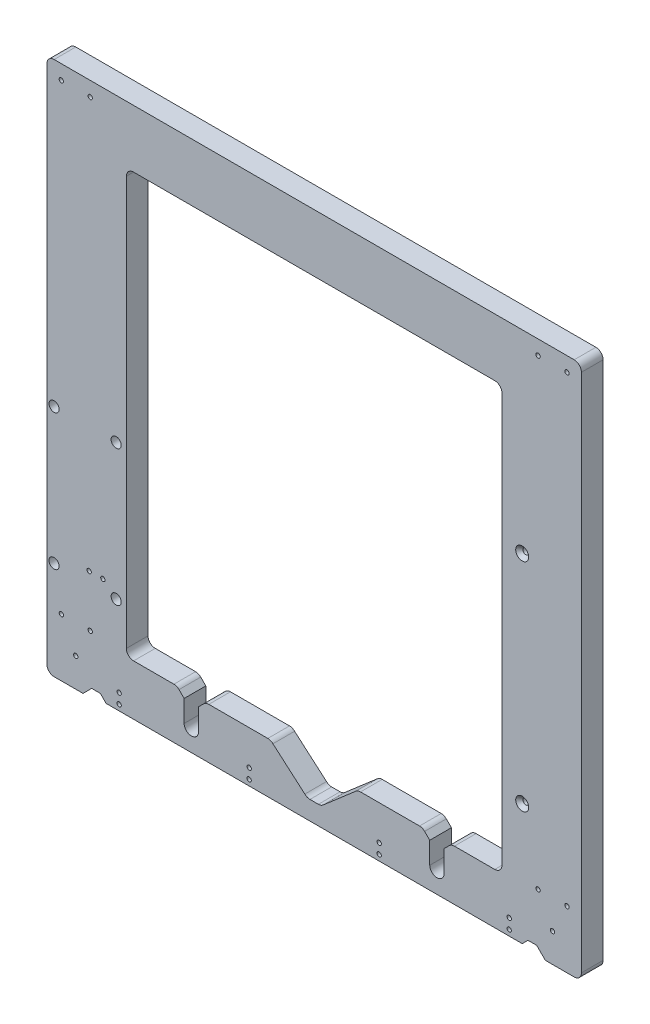
from build123d import *

# Parameters (mm, degrees)
MODEL_R                  = 1.5
MODEL_R_2                = 2
RESSALTO_EXTRUS_O1_DEPTH = 15
ESBO_O1_R                = 3.5
CORTE_EXTRUS_O1_DEPTH    = 7
ESBO_O2_R                = 3.5
CORTE_EXTRUS_O2_DEPTH    = 7
CHANFRO1_SIZE            = 2.5


with BuildPart() as part:
    # Model → Ressalto-extrusão1 (new body)
    with BuildSketch(Plane.XY):
        with BuildLine():
            Line((45.959420932, 55.536238099), (45.959420932, 415.536238099))
            ThreePointArc((45.959420932, 415.536238099), (47.423887026, 419.071772005), (50.959420932, 420.536238099))
            Line((50.959420932, 420.536238099), (410.959420932, 420.536238099))
            ThreePointArc((410.959420932, 420.536238099), (414.494954838, 419.071772005), (415.959420932, 415.536238099))
            Line((415.959420932, 415.536238099), (415.959420932, 55.536238099))
            ThreePointArc((415.959420932, 55.536238099), (414.494954838, 52.000704193), (410.959420932, 50.536238099))
            Line((410.959420932, 50.536238099), (390.959420932, 50.536238099))
            Line((390.959420932, 50.536238099), (388.959420932, 52.536238099))
            Line((388.959420932, 52.536238099), (384.959420932, 56.536238099))
            Line((384.959420932, 56.536238099), (378.959420932, 56.536238099))
            Line((378.959420932, 56.536238099), (374.959420932, 52.536238099))
            Line((374.959420932, 52.536238099), (86.959420932, 52.536238099))
            Line((86.959420932, 52.536238099), (82.959420932, 56.536238099))
            Line((82.959420932, 56.536238099), (76.959420932, 56.536238099))
            Line((76.959420932, 56.536238099), (72.959420932, 52.536238099))
            Line((72.959420932, 52.536238099), (70.959420932, 50.536238099))
            Line((70.959420932, 50.536238099), (50.959420932, 50.536238099))
            ThreePointArc((50.959420932, 50.536238099), (47.423887026, 52.000704193), (45.959420932, 55.536238099))
        make_face()
        with Locations((95.959420932, 56.536238099)):
            Circle(MODEL_R, mode=Mode.SUBTRACT)
        with Locations((365.959420932, 56.536238099)):
            Circle(MODEL_R, mode=Mode.SUBTRACT)
        with Locations((275.959420932, 56.536238099)):
            Circle(MODEL_R, mode=Mode.SUBTRACT)
        with Locations((185.959420932, 56.536238099)):
            Circle(MODEL_R, mode=Mode.SUBTRACT)
        with Locations((55.959420932, 90.536238099)):
            Circle(MODEL_R, mode=Mode.SUBTRACT)
        with Locations((75.959420932, 90.536238099)):
            Circle(MODEL_R, mode=Mode.SUBTRACT)
        with Locations((65.959420932, 70.536238099)):
            Circle(MODEL_R, mode=Mode.SUBTRACT)
        with Locations((395.959420932, 70.536238099)):
            Circle(MODEL_R, mode=Mode.SUBTRACT)
        with Locations((385.959420932, 90.536238099)):
            Circle(MODEL_R, mode=Mode.SUBTRACT)
        with Locations((405.959420932, 90.536238099)):
            Circle(MODEL_R, mode=Mode.SUBTRACT)
        with Locations((405.959420932, 410.536238099)):
            Circle(MODEL_R, mode=Mode.SUBTRACT)
        with Locations((385.959420932, 410.536238099)):
            Circle(MODEL_R, mode=Mode.SUBTRACT)
        with Locations((55.959420932, 410.536238099)):
            Circle(MODEL_R, mode=Mode.SUBTRACT)
        with Locations((75.959420932, 410.536238099)):
            Circle(MODEL_R, mode=Mode.SUBTRACT)
        with Locations((93.910965405, 118.501571518)):
            Circle(MODEL_R, mode=Mode.SUBTRACT)
        with Locations((50.910965405, 212.501571518)):
            Circle(MODEL_R, mode=Mode.SUBTRACT)
        with Locations((93.910965405, 212.501571518)):
            Circle(MODEL_R, mode=Mode.SUBTRACT)
        with Locations((50.876198806, 118.527793034)):
            Circle(MODEL_R, mode=Mode.SUBTRACT)
        with Locations((95.959420932, 63.536238099)):
            Circle(MODEL_R, mode=Mode.SUBTRACT)
        with Locations((365.959420932, 63.536238099)):
            Circle(MODEL_R, mode=Mode.SUBTRACT)
        with Locations((275.959420932, 63.536238099)):
            Circle(MODEL_R, mode=Mode.SUBTRACT)
        with Locations((185.959420932, 63.536238099)):
            Circle(MODEL_R, mode=Mode.SUBTRACT)
        with Locations((84.709420932, 126.036238099)):
            Circle(MODEL_R, mode=Mode.SUBTRACT)
        with Locations((75.209420932, 126.036238099)):
            Circle(MODEL_R, mode=Mode.SUBTRACT)
        with Locations((374.959420932, 136.436238099)):
            Circle(MODEL_R_2, mode=Mode.SUBTRACT)
        with Locations((374.959420932, 286.436238099)):
            Circle(MODEL_R_2, mode=Mode.SUBTRACT)
        with BuildLine():
            Line((140.959420932, 67.536238099), (140.959420932, 82.536238099))
            Line((140.959420932, 82.536238099), (137.423887026, 86.071772005))
            ThreePointArc((137.423887026, 86.071772005), (135.801770282, 87.155635761), (133.88835312, 87.536238099))
            Line((133.88835312, 87.536238099), (105.959420932, 87.536238099))
            ThreePointArc((105.959420932, 87.536238099), (102.423887026, 89.000704193), (100.959420932, 92.536238099))
            Line((100.959420932, 92.536238099), (100.959420932, 375.536238099))
            ThreePointArc((100.959420932, 375.536238099), (102.423887026, 379.071772005), (105.959420932, 380.536238099))
            Line((105.959420932, 380.536238099), (355.959420932, 380.536238099))
            ThreePointArc((355.959420932, 380.536238099), (359.494954838, 379.071772005), (360.959420932, 375.536238099))
            Line((360.959420932, 375.536238099), (360.959420932, 92.536238099))
            ThreePointArc((360.959420932, 92.536238099), (359.494954838, 89.000704193), (355.959420932, 87.536238099))
            Line((355.959420932, 87.536238099), (328.030488744, 87.536238099))
            ThreePointArc((328.030488744, 87.536238099), (326.117071582, 87.155635761), (324.494954838, 86.071772005))
            Line((324.494954838, 86.071772005), (320.959420932, 82.536238099))
            Line((320.959420932, 82.536238099), (320.959420932, 67.536238099))
            ThreePointArc((320.959420932, 67.536238099), (315.959420932, 62.536238099), (310.959420932, 67.536238099))
            Line((310.959420932, 67.536238099), (310.959420932, 82.536238099))
            Line((310.959420932, 82.536238099), (307.423887026, 86.071772005))
            ThreePointArc((307.423887026, 86.071772005), (305.801770282, 87.155635761), (303.88835312, 87.536238099))
            Line((303.88835312, 87.536238099), (263.030488744, 87.536238099))
            ThreePointArc((263.030488744, 87.536238099), (261.117071582, 87.155635761), (259.494954838, 86.071772005))
            Line((259.494954838, 86.071772005), (237.423887026, 67.000704193))
            ThreePointArc((237.423887026, 67.000704193), (235.801770282, 65.916840436), (233.88835312, 65.536238099))
            Line((233.88835312, 65.536238099), (228.030488744, 65.536238099))
            ThreePointArc((228.030488744, 65.536238099), (226.117071582, 65.916840436), (224.494954838, 67.000704193))
            Line((224.494954838, 67.000704193), (202.423887026, 86.071772005))
            ThreePointArc((202.423887026, 86.071772005), (200.801770282, 87.155635761), (198.88835312, 87.536238099))
            Line((198.88835312, 87.536238099), (158.030488744, 87.536238099))
            ThreePointArc((158.030488744, 87.536238099), (156.117071582, 87.155635761), (154.494954838, 86.071772005))
            Line((154.494954838, 86.071772005), (150.959420932, 82.536238099))
            Line((150.959420932, 82.536238099), (150.959420932, 67.536238099))
            ThreePointArc((150.959420932, 67.536238099), (145.959420932, 62.536238099), (140.959420932, 67.536238099))
        make_face(mode=Mode.SUBTRACT)
    extrude(amount=RESSALTO_EXTRUS_O1_DEPTH)

    # Esboço1 → Corte-extrusão1 (cut)
    with BuildSketch(Plane(origin=(0, 0, 0), x_dir=(-1, 0, 0), z_dir=(0, 0, -1))):
        with Locations((-385.959420932, 90.536238099)):
            Circle(ESBO_O1_R)
        with Locations((-405.959420932, 90.536238099)):
            Circle(ESBO_O1_R)
        with Locations((-395.959420932, 70.536238099)):
            Circle(ESBO_O1_R)
        with Locations((-75.959420932, 90.536238099)):
            Circle(ESBO_O1_R)
        with Locations((-55.959420932, 90.536238099)):
            Circle(ESBO_O1_R)
        with Locations((-65.959420932, 70.536238099)):
            Circle(ESBO_O1_R)
        with Locations((-405.959420932, 410.536238099)):
            Circle(ESBO_O1_R)
        with Locations((-385.959420932, 410.536238099)):
            Circle(ESBO_O1_R)
        with Locations((-75.959420932, 410.536238099)):
            Circle(ESBO_O1_R)
        with Locations((-55.959420932, 410.536238099)):
            Circle(ESBO_O1_R)
        with Locations((-84.709420932, 126.036238099)):
            Circle(ESBO_O1_R)
        with Locations((-75.209420932, 126.036238099)):
            Circle(ESBO_O1_R)
    extrude(amount=-CORTE_EXTRUS_O1_DEPTH, mode=Mode.SUBTRACT)

    # Esboço2 → Corte-extrusão2 (cut)
    with BuildSketch(Plane.XY.offset(15)):
        with Locations((50.910965405, 212.501571518)):
            Circle(ESBO_O2_R)
        with Locations((93.910965405, 212.501571518)):
            Circle(ESBO_O2_R)
        with Locations((93.910965405, 118.501571518)):
            Circle(ESBO_O2_R)
        with Locations((50.876198806, 118.527793034)):
            Circle(ESBO_O2_R)
    extrude(amount=-CORTE_EXTRUS_O2_DEPTH, mode=Mode.SUBTRACT)

    # Chanfro1
    chanfro1_edges = [part.edges().sort_by_distance(p)[0] for p in [
        (372.959420932, 136.436238099, 15),
        (372.959420932, 286.436238099, 15),
    ]]
    chamfer(chanfro1_edges, length=CHANFRO1_SIZE)


solid = part.part
